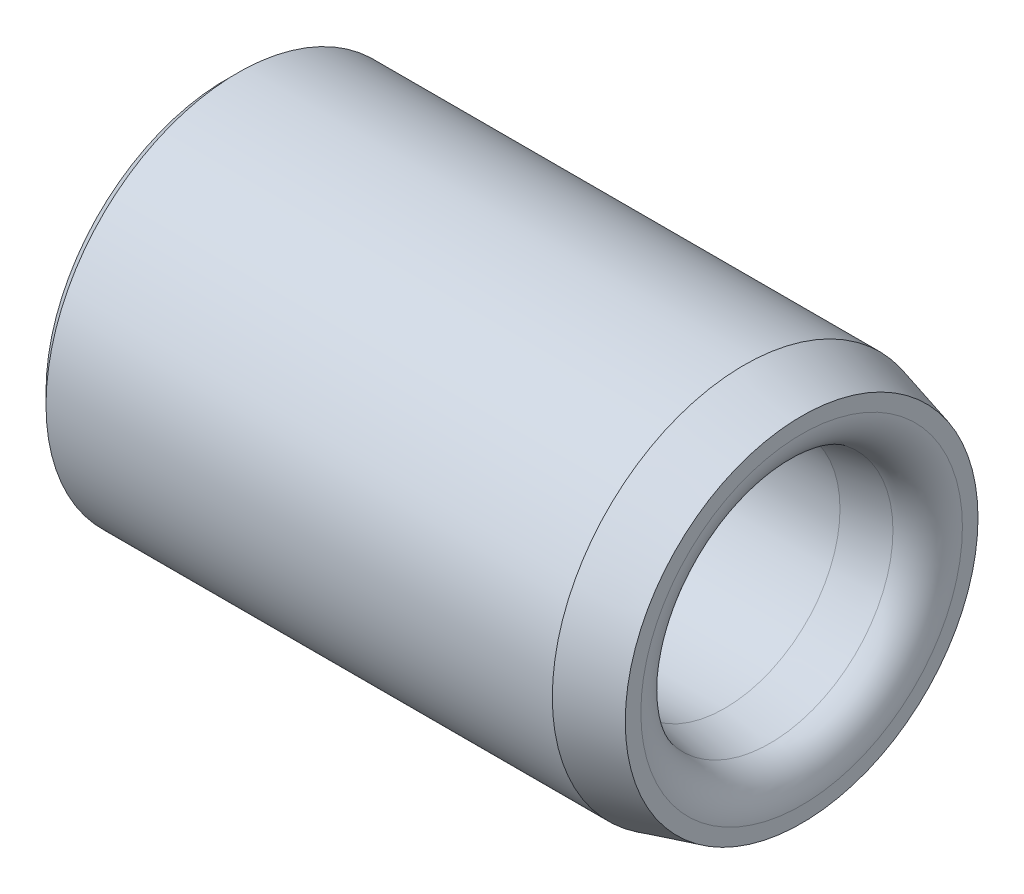
from build123d import *

# Parameters (mm, degrees)
SKETCH1_W      = 15
SKETCH1_H      = 2
CHAMFER1_SIZE  = 0.3
CHAMFER2_SIZE  = 1.5
CHAMFER2_SIZE2 = 0.401923789
CHAMFER3_SIZE  = 2
CHAMFER3_SIZE2 = 0.352653961
FILLET1_R      = 1


with BuildPart() as part:
    # Sketch1 → Revolve1 (revolve)
    with BuildSketch(Plane.XY):
        with Locations((7.5, 4)):
            Rectangle(SKETCH1_W, SKETCH1_H)
    revolve(axis=Axis((0, 0, 0), (1, 0, 0)))

    # Chamfer1
    chamfer1_edges = [part.edges().sort_by_distance(p)[0] for p in [
        (0, -5, 0),
    ]]
    chamfer(chamfer1_edges, length=CHAMFER1_SIZE)

    # Chamfer2
    chamfer2_edges = [part.edges().sort_by_distance(p)[0] for p in [
        (15, -5, 0),
    ]]
    chamfer2_side = [part.faces().sort_by_distance(p)[0] for p in [
        (7.65, -5, 0),
    ]]
    chamfer(chamfer2_edges, length=CHAMFER2_SIZE, length2=CHAMFER2_SIZE2, reference=chamfer2_side[0])

    # Chamfer3
    chamfer3_edges = [part.edges().sort_by_distance(p)[0] for p in [
        (0, -3, 0),
        (15, -3, 0),
    ]]
    chamfer3_side = [part.faces().sort_by_distance(p)[0] for p in [
        (7.5, -3, 0),
    ]]
    chamfer(chamfer3_edges, length=CHAMFER3_SIZE, length2=CHAMFER3_SIZE2, reference=chamfer3_side[0])

    # Fillet1
    fillet1_edges = [part.edges().sort_by_distance(p)[0] for p in [
        (0, -3.352653961, 0),
        (15, -3.352653961, 0),
    ]]
    fillet(fillet1_edges, radius=FILLET1_R)


solid = part.part
